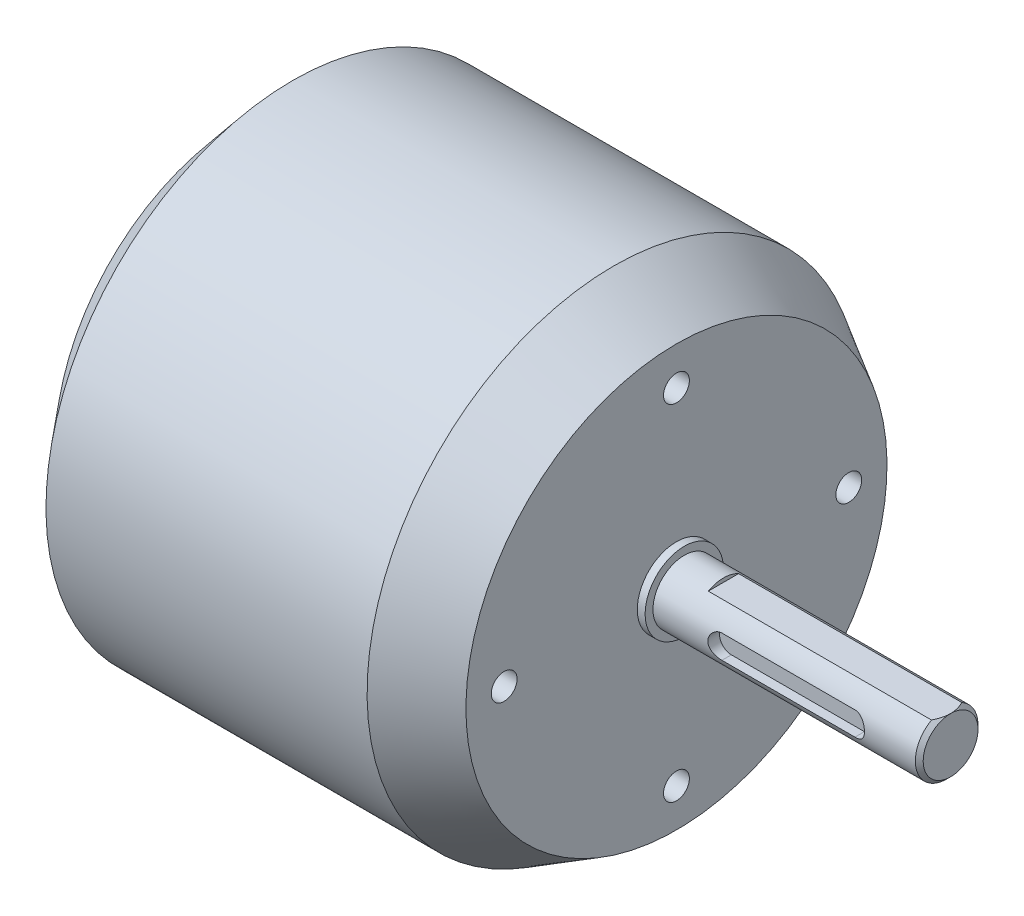
from build123d import *

# Parameters (mm, degrees)
SKIZZE2_R                       = 5
SKIZZE2_R_2                     = 4
AUFSATZ_LINEAR_AUSTRAGEN1_DEPTH = 1
SKIZZE2_2_R                     = 4
AUFSATZ_LINEAR_AUSTRAGEN2_DEPTH = 35
M4_GEWINDEBOHRUNG1_D            = 3.3
M4_GEWINDEBOHRUNG1_DEPTH        = 10
M4_GEWINDEBOHRUNG1_TIP          = 0.991420021
SCHNITT_LINEAR_AUSTRAGEN1_DEPTH = 1.5
SKIZZE7_W                       = 8
SKIZZE7_H                       = 3.641356754
SCHNITT_LINEAR_AUSTRAGEN2_DEPTH = 29
FASE1_SIZE                      = 0.5


with BuildPart() as part:
    # Skizze1 → Rotation1 (revolve)
    with BuildSketch(Plane.XY):
        Polygon((27.5, 0), (-27.5, 0), (-27.5, 24.349478444), (-21.5, 31.5), (19.5, 31.5), (27.5, 26.881197846), align=None)
    revolve(axis=Axis((27.5, 0, 0), (-1, 0, 0)))

    # Skizze2 → Aufsatz-Linear austragen1 (add)
    with BuildSketch(Plane(origin=(27.5, 0, 0), x_dir=(0, 0, -1), z_dir=(1, 0, 0))):
        with Locations(Location((0, 0, 0), (0, 0, 90))):
            Circle(SKIZZE2_R)
        with Locations(Location((0, 0, 0), (0, 0, 90))):
            Circle(SKIZZE2_R_2, mode=Mode.SUBTRACT)
    extrude(amount=AUFSATZ_LINEAR_AUSTRAGEN1_DEPTH)

    # Skizze2<2> → Aufsatz-Linear austragen2 (add)
    with BuildSketch(Plane(origin=(27.5, 0, 0), x_dir=(0, 0, -1), z_dir=(1, 0, 0))):
        with Locations(Location((0, 0, 0), (0, 0, 90))):
            Circle(SKIZZE2_2_R)
    extrude(amount=AUFSATZ_LINEAR_AUSTRAGEN2_DEPTH)

    # M4 Gewindebohrung1
    with Locations(Plane(origin=(27.5, 0, 0), x_dir=(0, 0, -1), z_dir=(1, 0, 0))):
        with Locations((0, 22), (0, -22), (22, 0), (-22, 0)):
            Hole(M4_GEWINDEBOHRUNG1_D / 2, depth=M4_GEWINDEBOHRUNG1_DEPTH)
            with Locations((0, 0, -(M4_GEWINDEBOHRUNG1_DEPTH + M4_GEWINDEBOHRUNG1_TIP / 2))):  # 118° drill point
                Cone(0, M4_GEWINDEBOHRUNG1_D / 2, M4_GEWINDEBOHRUNG1_TIP, mode=Mode.SUBTRACT)

    # Skizze6 → Schnitt-Linear austragen1 (cut)
    with BuildSketch(Plane.XY.offset(4)):
        with BuildLine():
            Line((37.00625, 1.50625), (53.99375, 1.50625))
            ThreePointArc((53.99375, 1.50625), (55.5, 0), (53.99375, -1.50625))
            Line((53.99375, -1.50625), (37.00625, -1.50625))
            ThreePointArc((37.00625, -1.50625), (35.5, 0), (37.00625, 1.50625))
        make_face()
    extrude(amount=-SCHNITT_LINEAR_AUSTRAGEN1_DEPTH, mode=Mode.SUBTRACT)

    # Skizze7 → Schnitt-Linear austragen2 (cut)
    with BuildSketch(Plane(origin=(62.5, 0, 0), x_dir=(0, 0, -1), z_dir=(1, 0, 0))):
        with Locations((0, 5.320678377)):
            Rectangle(SKIZZE7_W, SKIZZE7_H)
    extrude(amount=-SCHNITT_LINEAR_AUSTRAGEN2_DEPTH, mode=Mode.SUBTRACT)

    # Fase1
    fase1_edges = [part.edges().sort_by_distance(p)[0] for p in [
        (62.5, -4, 0),
    ]]
    chamfer(fase1_edges, length=FASE1_SIZE - 0.0001)  # a hair under: the kernel refuses the full size


solid = part.part
